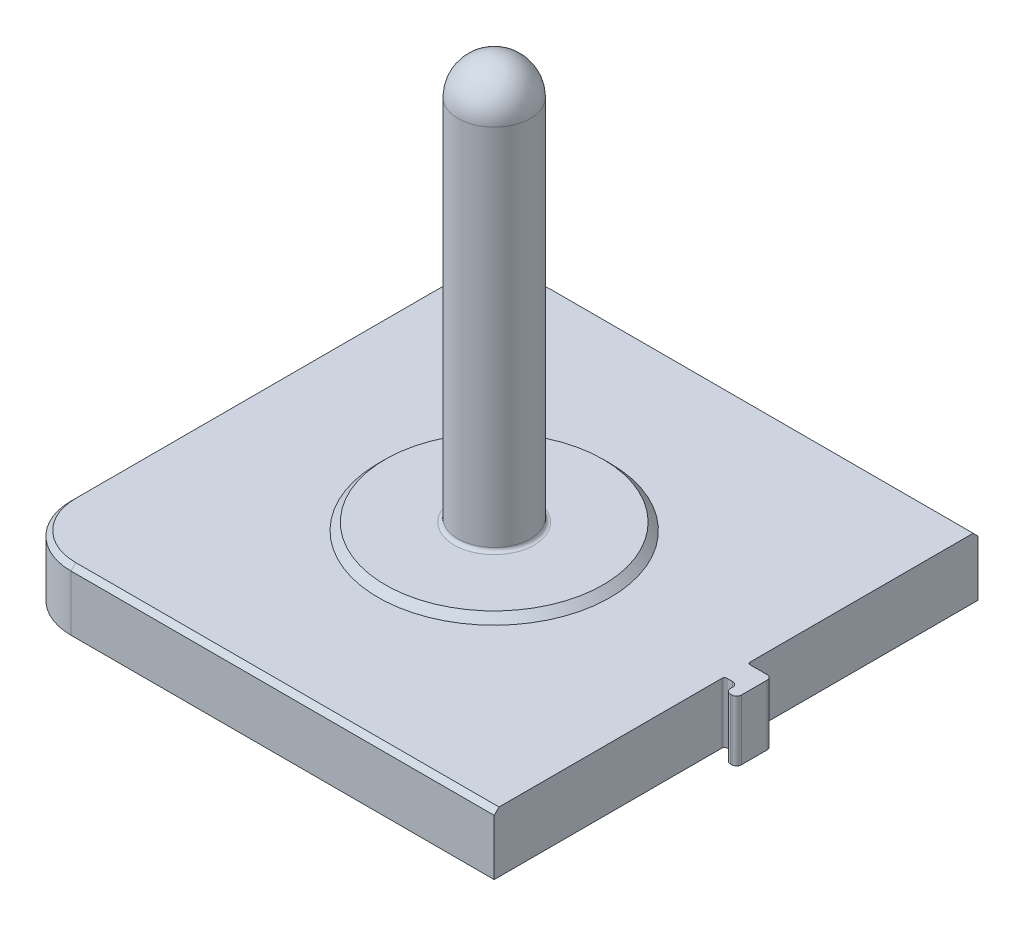
from build123d import *

# Parameters (mm, degrees)
SKETCH1_W           = 200
SKETCH1_H           = 200
BOSS_EXTRUDE1_DEPTH = 25
SKETCH2_R           = 15
BOSS_EXTRUDE2_DEPTH = 170
BOSS_EXTRUDE3_DEPTH = 25
FILLET1_R           = 1
FILLET2_R           = 25
FILLET3_R           = 15
SKETCH5_R           = 45
BOSS_EXTRUDE4_DEPTH = 3
CHAMFER1_SIZE       = 3
FILLET4_R           = 1.5
CHAMFER2_SIZE       = 2


with BuildPart() as part:
    # Sketch1 → Boss-Extrude1 (new body)
    with BuildSketch(Plane(origin=(0, 0, 0), x_dir=(1, 0, 0), z_dir=(0, 1, 0))):
        Rectangle(SKETCH1_W, SKETCH1_H)
    extrude(amount=BOSS_EXTRUDE1_DEPTH)

    # Sketch2 → Boss-Extrude2 (add)
    with BuildSketch(Plane(origin=(0, 25, 0), x_dir=(1, 0, 0), z_dir=(0, 1, 0))):
        with Locations(Location((0, 0, 0), (0, 0, 270))):
            Circle(SKETCH2_R)
    extrude(amount=BOSS_EXTRUDE2_DEPTH)

    # Sketch4 → Boss-Extrude3 (add)
    with BuildSketch(Plane(origin=(0, 0, 0), x_dir=(1, 0, 0), z_dir=(0, 1, 0))):
        with BuildLine():
            Line((100, 4.8), (108, 4.8))
            ThreePointArc((108, 4.8), (109.414213562, 4.214213562), (110, 2.8))
            Line((110, 2.8), (110, -7.8))
            ThreePointArc((110, -7.8), (109.414213562, -9.214213562), (108, -9.8))
            Line((108, -9.8), (107.4, -9.8))
            ThreePointArc((107.4, -9.8), (105.985786438, -9.214213562), (105.4, -7.8))
            Line((105.4, -7.8), (105.4, -6.8))
            ThreePointArc((105.4, -6.8), (104.814213562, -5.385786438), (103.4, -4.8))
            Line((103.4, -4.8), (100, -4.8))
            Line((100, -4.8), (100, 4.8))
        make_face()
    extrude(amount=BOSS_EXTRUDE3_DEPTH)

    # Fillet1
    fillet1_edges = [part.edges().sort_by_distance(p)[0] for p in [
        (100, 12.5, -4.8),
        (100, 12.5, 4.8),
    ]]
    fillet(fillet1_edges, radius=FILLET1_R)

    # Fillet2
    fillet2_edges = [part.edges().sort_by_distance(p)[0] for p in [
        (-100, 12.5, -100),
        (-100, 12.5, 100),
    ]]
    fillet(fillet2_edges, radius=FILLET2_R)

    # Fillet3
    fillet3_edges = [part.edges().sort_by_distance(p)[0] for p in [
        (0, 195, -15),
    ]]
    fillet(fillet3_edges, radius=FILLET3_R)

    # Sketch5 → Boss-Extrude4 (add)
    with BuildSketch(Plane(origin=(0, 25, 0), x_dir=(1, 0, 0), z_dir=(0, 1, 0))):
        with Locations(Location((0, 0, 0), (0, 0, 270))):
            Circle(SKETCH5_R)
    extrude(amount=BOSS_EXTRUDE4_DEPTH)

    # Chamfer1
    chamfer1_edges = [part.edges().sort_by_distance(p)[0] for p in [
        (0, 25, -45),
    ]]
    chamfer(chamfer1_edges, length=CHAMFER1_SIZE - 0.0001)  # a hair under: the kernel refuses the full size

    # Fillet4
    fillet4_edges = [part.edges().sort_by_distance(p)[0] for p in [
        (0, 28, -15),
    ]]
    fillet(fillet4_edges, radius=FILLET4_R)

    # Chamfer2
    chamfer2_edges = [part.edges().sort_by_distance(p)[0] for p in [
        (12.5, 25, -100),
        (-100, 25, 0),
        (12.5, 25, 100),
        (-92.67766953, 25, 92.67766953),
        (-92.67766953, 25, -92.67766953),
    ]]
    chamfer(chamfer2_edges, length=CHAMFER2_SIZE)


solid = part.part
